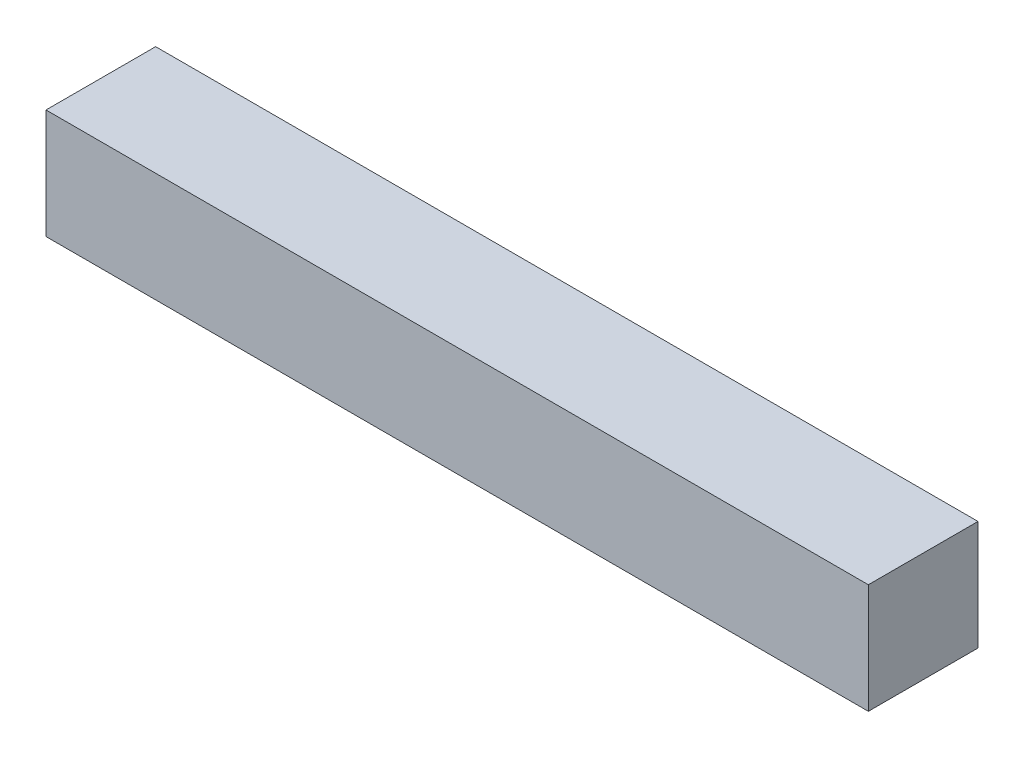
from build123d import *

# Parameters (mm, degrees)
BOSS_EXTRUDE1_DEPTH      = 75
BOSS_EXTRUDE1_DEPTH_BACK = 75
SKETCH1_W                = 20
SKETCH1_H                = 20


with BuildPart() as part:
    # Sketch1 → Boss-Extrude1 (new, two sides: drawn at the far end of the back side and taken through both)
    with BuildSketch(Plane(origin=(0, 0, 0), x_dir=(0, 0, -1), z_dir=(1, 0, 0)).offset(-BOSS_EXTRUDE1_DEPTH_BACK)):
        Rectangle(SKETCH1_W, SKETCH1_H)
    extrude(amount=BOSS_EXTRUDE1_DEPTH + BOSS_EXTRUDE1_DEPTH_BACK)


solid = part.part
